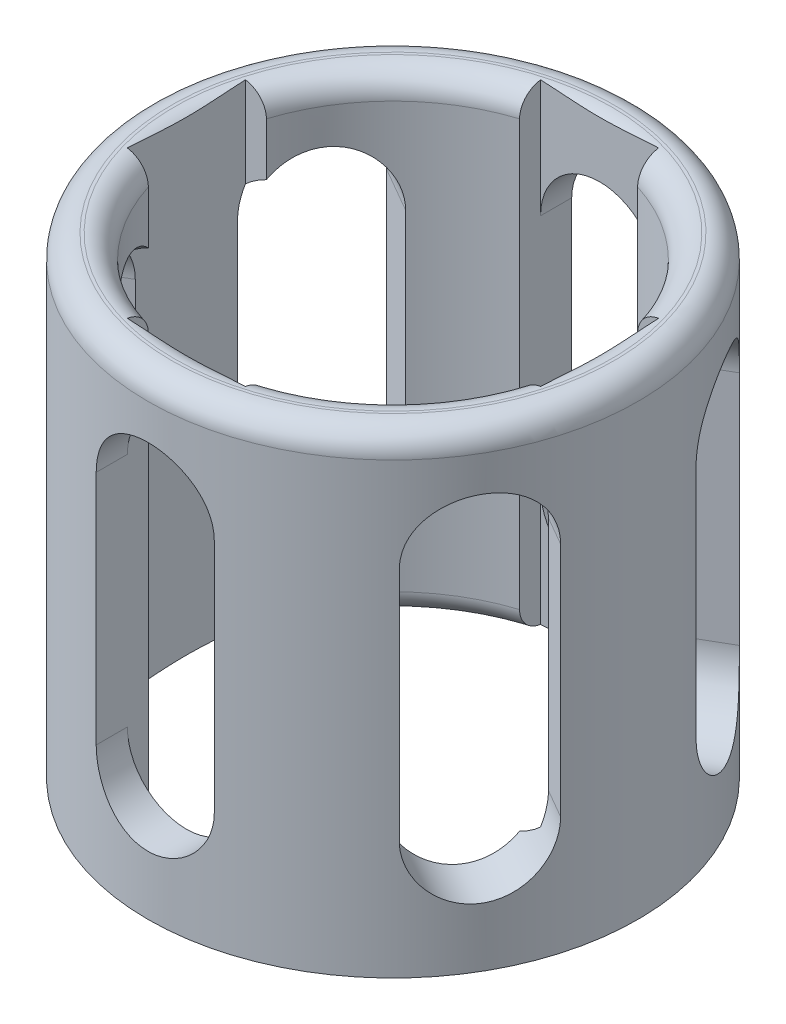
from build123d import *

# Parameters (mm, degrees)
SKETCH1_R           = 20.75
SKETCH1_R_2         = 16.5
BOSS_EXTRUDE1_DEPTH = 40
CUT_EXTRUDE1_DEPTH  = 20
CIRPATTERN1_COUNT   = 6
FILLET1_R           = 2
SKETCH3_W           = 10
SKETCH3_H           = 2
CUT_EXTRUDE2_DEPTH  = 50.609726957
CIRPATTERN2_COUNT   = 4


with BuildPart() as part:
    # Sketch1 → Boss-Extrude1 (new body)
    with BuildSketch(Plane(origin=(0, 0, 0), x_dir=(1, 0, 0), z_dir=(0, 1, 0))):
        Circle(SKETCH1_R)
        Circle(SKETCH1_R_2, mode=Mode.SUBTRACT)
    extrude(amount=BOSS_EXTRUDE1_DEPTH)

    # Sketch2 → Cut-Extrude1 (cut)
    with BuildSketch(Plane.XY.offset(20.75)):
        with BuildLine():
            ThreePointArc((5, 30), (0, 35), (-5, 30))
            Line((-5, 30), (-5, 10))
            ThreePointArc((-5, 10), (0, 5), (5, 10))
            Line((5, 10), (5, 30))
        make_face()
    cut_extrude1 = extrude(amount=-CUT_EXTRUDE1_DEPTH, mode=Mode.SUBTRACT)

    # CirPattern1: Cut-Extrude1 ×6 about axis
    cirpattern1_axis = Axis((0, 40, 0), (0, -1, 0))
    for i in range(1, CIRPATTERN1_COUNT):
        add(cut_extrude1.rotate(cirpattern1_axis, i * 360 / CIRPATTERN1_COUNT), mode=Mode.SUBTRACT)

    # Fillet1
    fillet1_edges = [part.edges().sort_by_distance(p)[0] for p in [
        (-20.75, 40, 0),
        (-16.5, 0, 0),
        (-16.5, 40, 0),
    ]]
    fillet(fillet1_edges, radius=FILLET1_R)

    # Sketch3 → Cut-Extrude2 (cut, through all)
    with BuildSketch(Plane.XZ):
        with Locations((0, 16.5)):
            Rectangle(SKETCH3_W, SKETCH3_H)
    cut_extrude2 = extrude(amount=-CUT_EXTRUDE2_DEPTH, mode=Mode.SUBTRACT)

    # CirPattern2: Cut-Extrude2 ×4 about axis
    cirpattern2_axis = Axis((0, 38, 0), (0, -1, 0))
    for i in range(1, CIRPATTERN2_COUNT):
        add(cut_extrude2.rotate(cirpattern2_axis, i * 360 / CIRPATTERN2_COUNT), mode=Mode.SUBTRACT)


solid = part.part
